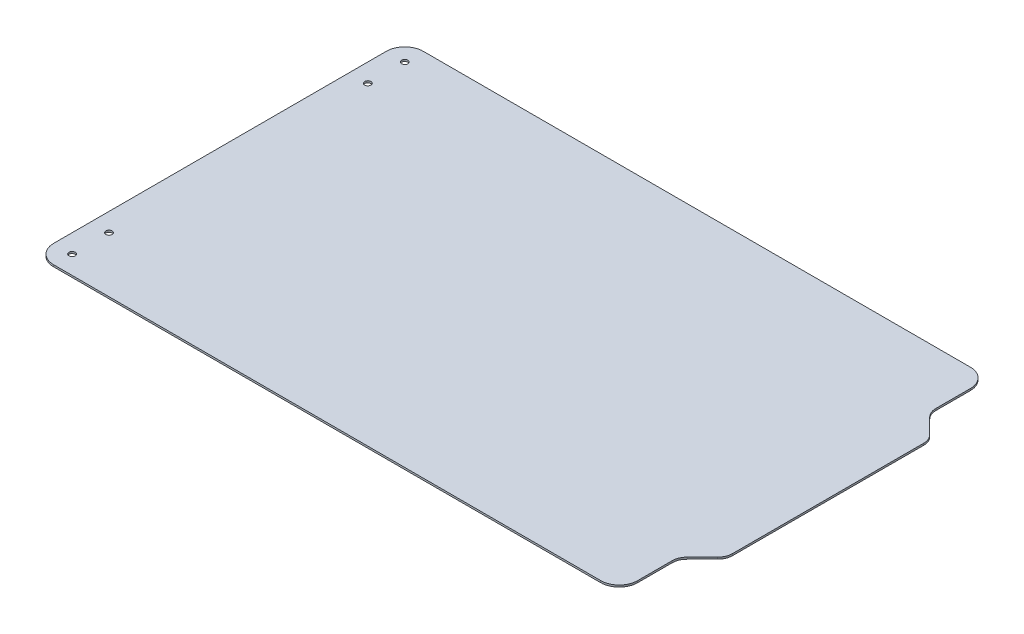
from build123d import *

# Parameters (mm, degrees)
SKETCH1_W           = 329
SKETCH1_H           = 200
BOSS_EXTRUDE1_DEPTH = 1
CUT_EXTRUDE1_DEPTH  = 193.512986575
FILLET1_R           = 8
FILLET2_R           = 10
SKETCH3_R           = 1.7
CUT_EXTRUDE2_DEPTH  = 193.512986575


with BuildPart() as part:
    # Sketch1 → Boss-Extrude1 (new body)
    with BuildSketch(Plane(origin=(0, 0, 0), x_dir=(1, 0, 0), z_dir=(0, 1, 0))):
        Rectangle(SKETCH1_W, SKETCH1_H)
    extrude(amount=BOSS_EXTRUDE1_DEPTH)

    # Sketch2 → Cut-Extrude1 (cut, through all)
    with BuildSketch(Plane(origin=(0, 0, 0), x_dir=(-1, 0, 0), z_dir=(0, -1, 0))):
        Polygon((-164.5, -55), (-151.5, -68), (-151.5, -100), (-164.5, -100), align=None)
        Polygon((-151.5, 100), (-164.5, 100), (-164.5, 55), (-151.5, 68), align=None)
    extrude(amount=-CUT_EXTRUDE1_DEPTH, mode=Mode.SUBTRACT)

    # Fillet1
    fillet1_edges = [part.edges().sort_by_distance(p)[0] for p in [
        (151.5, 0.5, -68),
        (164.5, 0.5, -55),
        (151.5, 0.5, 68),
        (164.5, 0.5, 55),
    ]]
    fillet(fillet1_edges, radius=FILLET1_R)

    # Fillet2
    fillet2_edges = [part.edges().sort_by_distance(p)[0] for p in [
        (151.5, 0.5, -100),
        (-164.5, 0.5, -100),
        (-164.5, 0.5, 100),
        (151.5, 0.5, 100),
    ]]
    fillet(fillet2_edges, radius=FILLET2_R)

    # Sketch3 → Cut-Extrude2 (cut, through all)
    with BuildSketch(Plane.XZ):
        with Locations((-154.5, -70)):
            Circle(SKETCH3_R)
        with Locations((-154.5, -90)):
            Circle(SKETCH3_R)
        with Locations((-154.5, 70)):
            Circle(SKETCH3_R)
        with Locations((-154.5, 90)):
            Circle(SKETCH3_R)
    extrude(amount=-CUT_EXTRUDE2_DEPTH, mode=Mode.SUBTRACT)


solid = part.part
